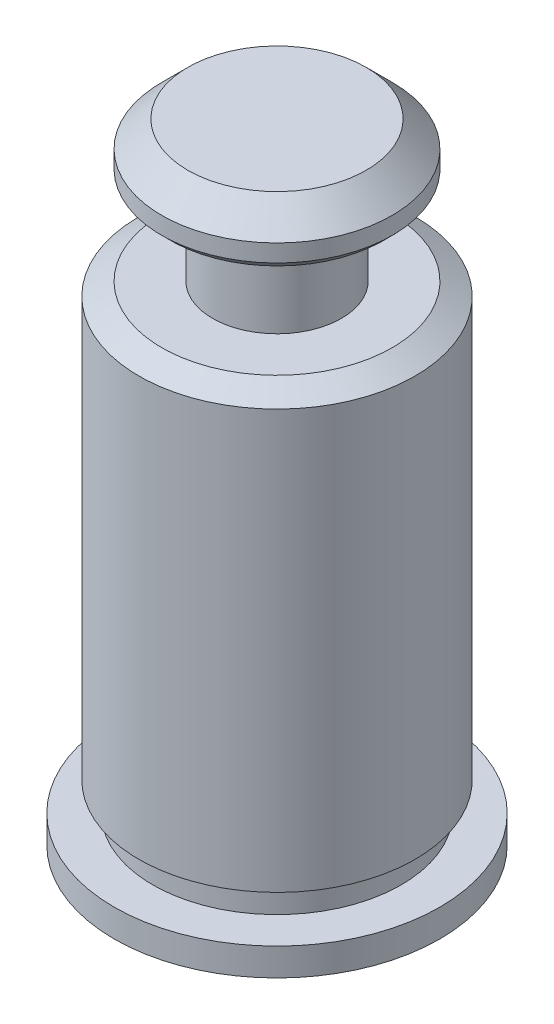
from build123d import *


with BuildPart() as part:
    # BodySke → Body (revolve)
    with BuildSketch(Plane.XY):
        Polygon((2.6924, 0), (3.175, 0), (3.175, 0.53848), (2.42316, 0.53848), (2.42316, 1.103884), (2.6924, 1.103884), (2.6924, 9.268367805), (2.2479, 9.525), (1.2573, 9.525), (1.2573, 11.2522), (2.078566667, 11.2522), (2.2479, 11.421533333), (2.2479, 11.7602), (1.7399, 12.2682), (0, 12.2682), (0, 0.00508), (2.6924, 0.00508), align=None)
    revolve(axis=Axis((0, 0, 0), (0, 1, 0)))


solid = part.part
